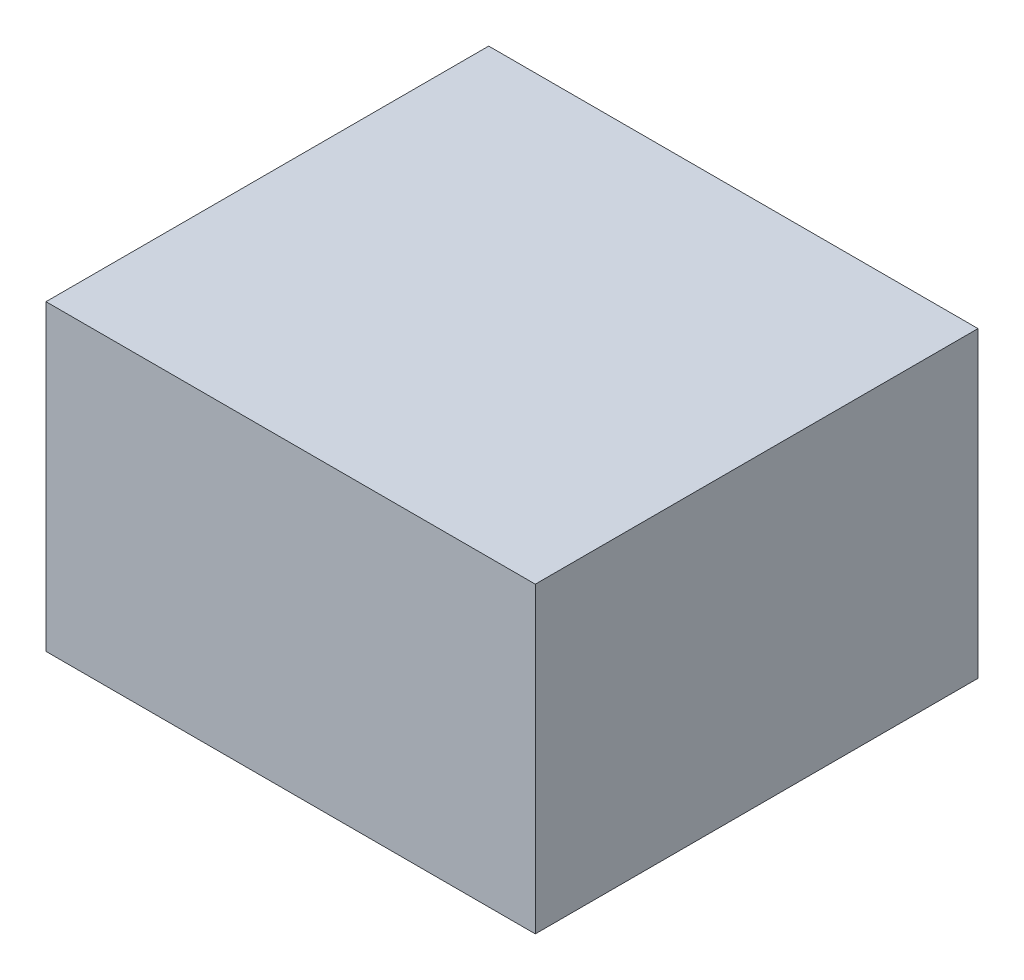
from build123d import *

# Parameters (mm, degrees)
SKETCH_1_W      = 42
SKETCH_1_H      = 26
EXTRUDE_1_DEPTH = 19


with BuildPart() as part:
    # 草图1 → 凸台-拉伸1 (new, symmetric)
    with BuildSketch(Plane.XY):
        Rectangle(SKETCH_1_W, SKETCH_1_H)
    extrude(amount=EXTRUDE_1_DEPTH, both=True)


solid = part.part
